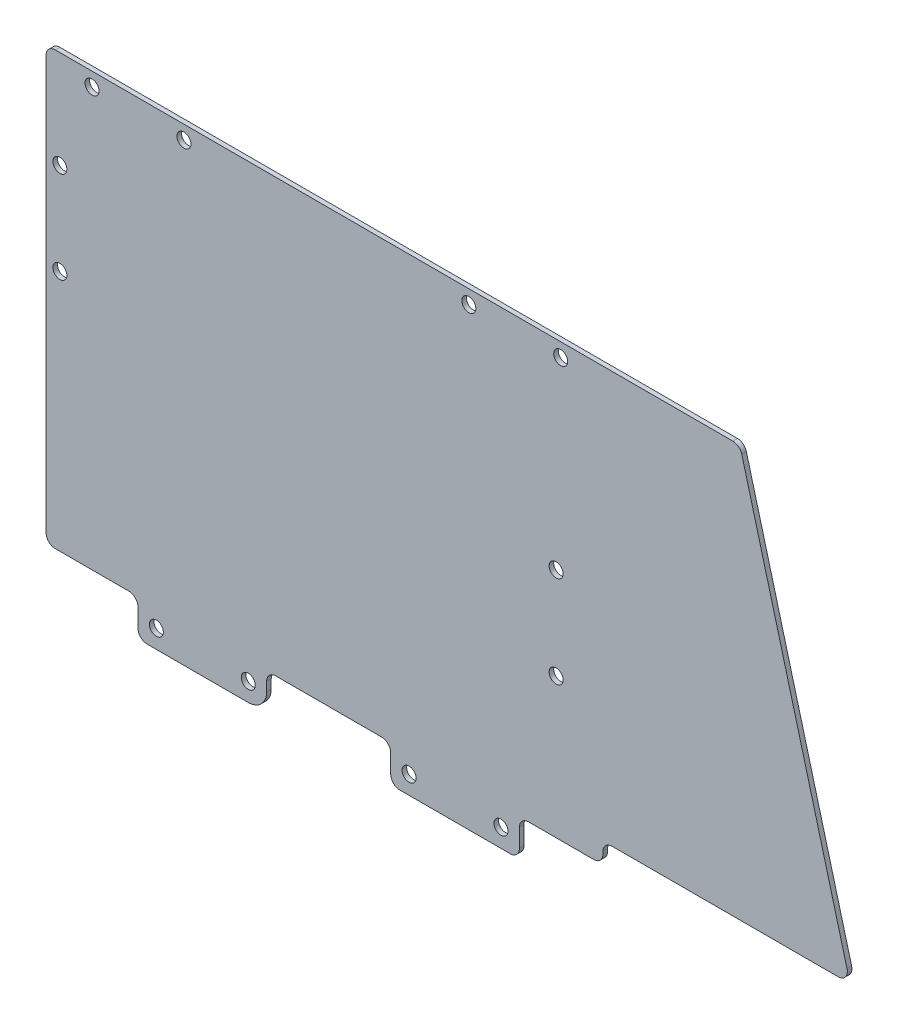
from build123d import *

# Parameters (mm, degrees)
SKETCH_1_W                 = 28
SKETCH_1_H                 = 8
SKETCH_1_R                 = 1.525
EXTRUDE_1_DEPTH            = 1
SKETCH_3_R                 = 1.525
CUT_EXTRUDE_1_DEPTH        = 10
SKETCH_5_R                 = 1.525
CUT_EXTRUDE_3_DEPTH        = 10
SKETCH_6_R                 = 1.525
CUT_EXTRUDE_4_DEPTH        = 10
EXTRUDE_2_DEPTH            = 1
SKETCH_9_W                 = 55
SKETCH_9_H                 = 4.5
CUT_EXTRUDE_5_DEPTH        = 20.5
FILLET_1_R                 = 2
SKETCH_10_R                = 1.525
CUT_EXTRUDE_6_DEPTH        = 10
SKETCH_11_W                = 28
SKETCH_11_H                = 8
SKETCH_11_R                = 1.525
EXTRUDE_3_DEPTH            = 1
FILLET_2_R                 = 2
SKETCH_12_W                = 29
SKETCH_12_H                = 8
CUT_EXTRUDE_7_DEPTH        = 10
PATTERN_LINEAR_1_OUTLINE_R = 1.525
PATTERN_LINEAR_1_DEPTH     = 1
CUT_EXTRUDE_8_DEPTH        = 10
FILLET_3_R                 = 2
FILLET_4_R                 = 2


with BuildPart() as part:
    # 草图1 → 凸台-拉伸1 (new body)
    # profile 1 of 2: a face of its own
    with BuildSketch(Plane.XY):
        Polygon((-4, 4), (24, 4), (100, 4), (100, 98), (-51, 98), (-51, 4), align=None)
    # profile 2 of 2: a face of its own
    with BuildSketch(Plane.XY):
        with Locations((10, 0)):
            Rectangle(SKETCH_1_W, SKETCH_1_H)
        with Locations((20, 0)):
            Circle(SKETCH_1_R, mode=Mode.SUBTRACT)
        Circle(SKETCH_1_R, mode=Mode.SUBTRACT)
    extrude(amount=EXTRUDE_1_DEPTH)

    # 草图3 → 切除-拉伸1 (cut)
    with BuildSketch(Plane.XY.offset(1)):
        with Locations((-48, 76.75)):
            Circle(SKETCH_3_R)
        with Locations((-48, 56.75)):
            Circle(SKETCH_3_R)
    extrude(amount=-CUT_EXTRUDE_1_DEPTH, mode=Mode.SUBTRACT)

    # 草图5 → 切除-拉伸3 (cut)
    with BuildSketch(Plane.XY.offset(1)):
        with Locations((-41, 95)):
            Circle(SKETCH_5_R)
        with Locations((-21, 95)):
            Circle(SKETCH_5_R)
    extrude(amount=-CUT_EXTRUDE_3_DEPTH, mode=Mode.SUBTRACT)

    # 草图6 → 切除-拉伸4 (cut)
    with BuildSketch(Plane.XY.offset(1)):
        with Locations((41, 95)):
            Circle(SKETCH_6_R)
        with Locations((61, 95)):
            Circle(SKETCH_6_R)
    extrude(amount=-CUT_EXTRUDE_4_DEPTH, mode=Mode.SUBTRACT)

    # 草图7 → 凸台-拉伸2 (add)
    with BuildSketch(Plane.XY.offset(1)):
        Polygon((100, 98), (125.187224089, 4), (100, 4), align=None)
    extrude(amount=-EXTRUDE_2_DEPTH)

    # 草图9 → 切除-拉伸5 (cut)
    with BuildSketch(Plane.XY.offset(1)):
        with Locations((97.687224089, 6.25)):
            Rectangle(SKETCH_9_W, SKETCH_9_H)
    extrude(amount=-CUT_EXTRUDE_5_DEPTH, mode=Mode.SUBTRACT)

    # 圆角1
    fillet_1_edges = [part.edges().sort_by_distance(p)[0] for p in [
        (24, 4, 0.5),
        (24, -4, 0.5),
        (-4, -4, 0.5),
        (-4, 4, 0.5),
        (-51, 4, 0.5),
        (-51, 98, 0.5),
        (100, 98, 0.5),
        (123.981452723, 8.5, 0.5),
        (70.187224089, 4, 0.5),
        (70.187224089, 8.5, 0.5),
    ]]
    fillet(fillet_1_edges, radius=FILLET_1_R)

    # 草图10 → 切除-拉伸6 (cut)
    with BuildSketch(Plane.XY.offset(1)):
        with Locations((60, 34.5)):
            Circle(SKETCH_10_R)
        with Locations((60, 54.5)):
            Circle(SKETCH_10_R)
    extrude(amount=-CUT_EXTRUDE_6_DEPTH, mode=Mode.SUBTRACT)

    # 草图11 → 凸台-拉伸3 (add)
    with BuildSketch(Plane.XY.offset(1)):
        with Locations((-17, 0)):
            Rectangle(SKETCH_11_W, SKETCH_11_H)
        with Locations((-27, 0)):
            Circle(SKETCH_11_R, mode=Mode.SUBTRACT)
        with Locations((-7, 0)):
            Circle(SKETCH_11_R, mode=Mode.SUBTRACT)
    extrude(amount=-EXTRUDE_3_DEPTH)

    # 圆角2
    # the kernel refuses this fillet: 2 mm, written as the material it adds along each edge
    with BuildSketch(Plane(origin=(-31, 4, 1), x_dir=(-1, 0, 0), z_dir=(0, 0, -1))) as fillet_2_piece_1:
        with BuildLine():
            CenterArc((FILLET_2_R, -FILLET_2_R), FILLET_2_R, 90, 90)
            Line((0, -FILLET_2_R), (0, 0))
            Line((0, 0), (FILLET_2_R, 0))
        make_face()
    extrude(amount=1)
    # the kernel refuses this fillet: 2 mm, written as the material it takes off along each edge
    with BuildSketch(Plane(origin=(-3, -4, 3.5), x_dir=(-1, 0, 0), z_dir=(0, 0, -1))) as fillet_2_2_piece_1:
        with BuildLine():
            CenterArc((1, 2), FILLET_2_R, 240, 30)
            Line((0, 0.267949192), (0, 0))
            Line((0, 0), (1, 0))
        make_face()
    extrude(amount=6, mode=Mode.SUBTRACT)
    with BuildSketch(Plane(origin=(-31, -4, 6), x_dir=(0, 1, 0), z_dir=(0, 0, -1))) as fillet_2_2_piece_2:
        with BuildLine():
            CenterArc((FILLET_2_R, FILLET_2_R), FILLET_2_R, 180, 90)
            Line((0, FILLET_2_R), (0, 0))
            Line((0, 0), (FILLET_2_R, 0))
        make_face()
    extrude(amount=11, mode=Mode.SUBTRACT)

    # 草图12 → 切除-拉伸7 (cut)
    with BuildSketch(Plane.XY.offset(1)):
        with Locations((11.5, 0)):
            Rectangle(SKETCH_12_W, SKETCH_12_H)
    extrude(amount=-CUT_EXTRUDE_7_DEPTH, mode=Mode.SUBTRACT)

    # 阵列(线性)1: read off the stored shape, not the designer's step
    # 阵列(线性)1 outline → 阵列(线性)1 (add)
    with BuildSketch(Plane.XY):
        with BuildLine():
            ThreePointArc((24, -2), (24.585786438, -3.414213562), (26, -4))
            Line((26, -4), (50, -4))
            ThreePointArc((50, -4), (51.414213562, -3.414213562), (52, -2))
            Line((52, -2), (52, 4))
            Line((52, 4), (22, 4))
            ThreePointArc((22, 4), (23.414213562, 3.414213562), (24, 2))
            Line((24, 2), (24, -2))
        make_face()
        with Locations((28, 0)):
            Circle(PATTERN_LINEAR_1_OUTLINE_R, mode=Mode.SUBTRACT)
        with Locations((48, 0)):
            Circle(PATTERN_LINEAR_1_OUTLINE_R, mode=Mode.SUBTRACT)
    extrude(amount=PATTERN_LINEAR_1_DEPTH)

    # 草图13 → 切除-拉伸8 (cut)
    with BuildSketch(Plane.XY.offset(1)):
        with BuildLine():
            ThreePointArc((-3, 0), (-4.171572875, -2.828427125), (-7, -4))
            Line((-7, -4), (-4, -4))
            ThreePointArc((-4, -4), (-3.48236191, -3.931851653), (-3, -3.732050808))
            Line((-3, -3.732050808), (-3, 0))
        make_face()
    extrude(amount=-CUT_EXTRUDE_8_DEPTH, mode=Mode.SUBTRACT)

    # 圆角3
    fillet_3_edges = [part.edges().sort_by_distance(p)[0] for p in [
        (-3, 4, 0.5),
    ]]
    fillet(fillet_3_edges, radius=FILLET_3_R)

    # 圆角4
    fillet_4_edges = [part.edges().sort_by_distance(p)[0] for p in [
        (52, 4, 0.5),
    ]]
    fillet(fillet_4_edges, radius=FILLET_4_R)


solid = part.part
